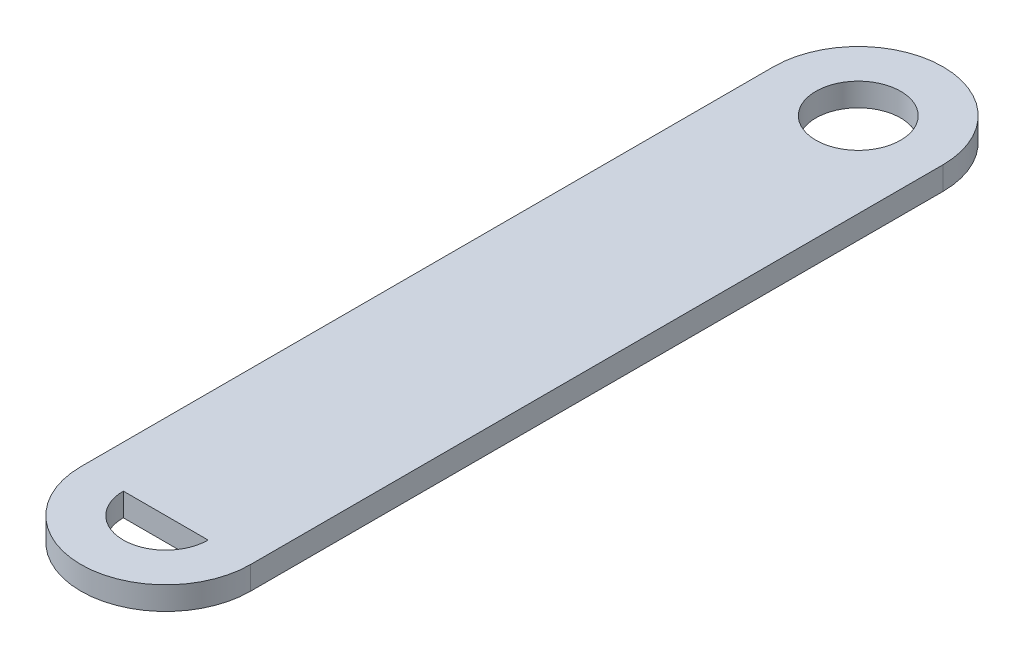
from build123d import *

# Parameters (mm, degrees)
SKETCH2_R           = 5.5
BOSS_EXTRUDE1_DEPTH = 3


with BuildPart() as part:
    # Sketch2 → Boss-Extrude1 (new body)
    with BuildSketch(Plane(origin=(0, 0, 0), x_dir=(1, 0, 0), z_dir=(0, 1, 0))):
        with BuildLine():
            Line((-11, 89.071288744), (-11, -0.748711256))
            ThreePointArc((-11, -0.748711256), (0, -11.748711256), (11, -0.748711256))
            Line((11, -0.748711256), (11, 89.071288744))
            ThreePointArc((11, 89.071288744), (0, 100.071288744), (-11, 89.071288744))
        make_face()
        with Locations((0, 89.071288744)):
            Circle(SKETCH2_R, mode=Mode.SUBTRACT)
        with BuildLine():
            Line((-5.5, -0.748711256), (5.5, -0.748711256))
            ThreePointArc((5.5, -0.748711256), (0, -6.248711256), (-5.5, -0.748711256))
        make_face(mode=Mode.SUBTRACT)
    extrude(amount=BOSS_EXTRUDE1_DEPTH)


solid = part.part
